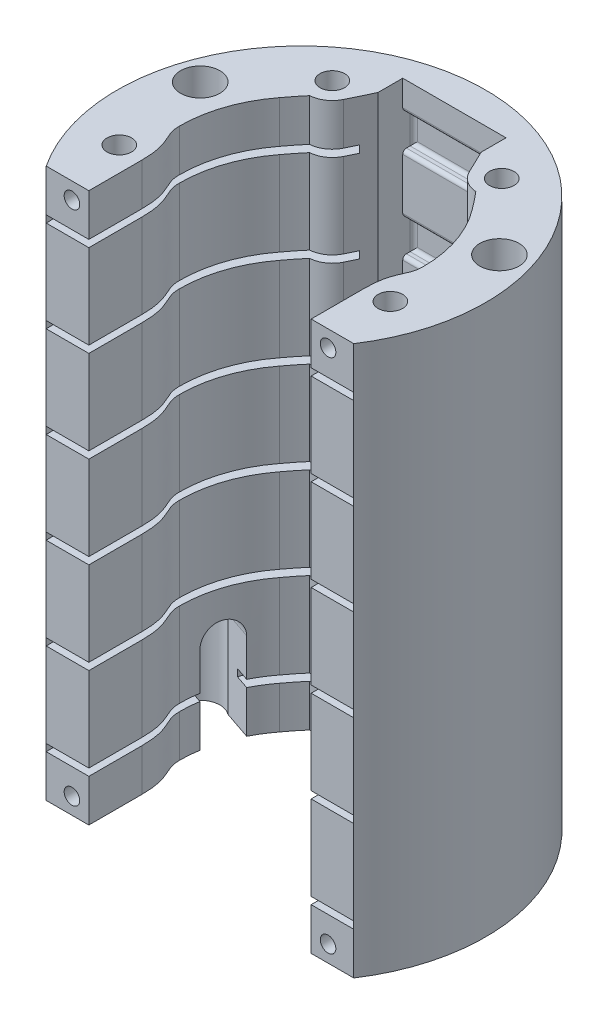
from build123d import *

# Parameters (mm, degrees)
SKETCH1_R               = 3.35
SKETCH1_R_2             = 5.3721
BOSS_EXTRUDE2_DEPTH     = 150
SLOT_DEPTH              = 0.975
SKETCH2_W               = 28.2
SKETCH2_H               = 9.048762348
CUT_EXTRUDE1_DEPTH      = 3
FILLET1_R               = 1
LPATTERN1_COUNT         = 6
LPATTERN1_PITCH         = 25
FILLET1_OF_LPATTERN1_R  = 1
SKETCH7_R               = 2.125
CUT_EXTRUDE2_DEPTH      = 8
CUT_EXTRUDE3_DEPTH      = 10
MIRROR2_COPY_1_SKETCH_R = 2.125
MIRROR2_COPY_1_DEPTH    = 8


with BuildPart() as part:
    # Sketch1 → Boss-Extrude2 (new body)
    with BuildSketch(Plane(origin=(0, 0, 0), x_dir=(1, 0, 0), z_dir=(0, 1, 0))):
        with BuildLine():
            Line((-41.978758021, -27.696013052), (-30.348758021, -27.696013052))
            Line((-30.348758021, -27.696013052), (-30.348758021, -13.232808954))
            add(Edge.make_bspline(
                [(-30.348758021, -13.232808954), (-30.348758021, -4.818714921), (-33.264468406, -4.744134389), (-33.264468406, 0)],
                knots=[0, 0, 0, 0, 1, 1, 1, 1], degree=3))
            ThreePointArc((-33.264468406, 0), (-31.488556898, 10.723602139), (-26.350445826, 20.302188629))
            add(Edge.make_bspline(
                [(-26.350445826, 20.302188629), (-24.374677003, 22.988127573), (-22.681011433, 24.921676571)],
                knots=[0, 0, 0, 1, 1, 1], degree=2))
            ThreePointArc((-22.681011433, 24.921676571), (-19.402847958, 26.048993856), (-17.137442499, 28.672948531))
            Line((-17.137442499, 28.672948531), (-14.1, 34.984991814))
            Line((-14.1, 34.984991814), (-14.1, 41.76))
            Line((-14.1, 41.76), (14.1, 41.76))
            Line((14.1, 41.76), (14.1, 34.984991814))
            Line((14.1, 34.984991814), (17.137442499, 28.672948531))
            ThreePointArc((17.137442499, 28.672948531), (19.402847958, 26.048993856), (22.681011433, 24.921676571))
            add(Edge.make_bspline(
                [(26.350445826, 20.302188629), (24.374677003, 22.988127573), (22.681011433, 24.921676571)],
                knots=[0, 0, 0, 1, 1, 1], degree=2))
            ThreePointArc((26.350445826, 20.302188629), (31.488556898, 10.723602139), (33.264468406, 0))
            add(Edge.make_bspline(
                [(30.348758021, -13.232808954), (30.348758021, -4.818714921), (33.264468406, -4.744134389), (33.264468406, 0)],
                knots=[0, 0, 0, 0, 1, 1, 1, 1], degree=3))
            Line((30.348758021, -13.232808954), (30.348758021, -27.696013052))
            Line((30.348758021, -27.696013052), (41.978758021, -27.696013052))
            ThreePointArc((41.978758021, -27.696013052), (0, 50.292), (-41.978758021, -27.696013052))
        make_face()
        with Locations((-37.000474826, -12.718618748)):
            Circle(SKETCH1_R, mode=Mode.SUBTRACT)
        with Locations((37.000474826, -12.718618748)):
            Circle(SKETCH1_R, mode=Mode.SUBTRACT)
        with Locations((-40.847062798, 13.209934169)):
            Circle(SKETCH1_R_2, mode=Mode.SUBTRACT)
        with Locations((-23.129730363, 31.556520301)):
            Circle(SKETCH1_R, mode=Mode.SUBTRACT)
        with Locations((40.847062798, 13.209934169)):
            Circle(SKETCH1_R_2, mode=Mode.SUBTRACT)
        with Locations((23.129730363, 31.556520301)):
            Circle(SKETCH1_R, mode=Mode.SUBTRACT)
    extrude(amount=BOSS_EXTRUDE2_DEPTH)

    # Sketch6 → slot (cut, symmetric)
    with BuildSketch(Plane(origin=(0, 12.5, 0), x_dir=(-1, 0, 0), z_dir=(0, -1, 0))):
        with BuildLine():
            Line((-41.978758021, -27.696013052), (41.978758021, -27.696013052))
            Line((41.978758021, -27.696013052), (42.348813141, -12.851950168))
            ThreePointArc((42.348813141, -12.851950168), (42.298623582, -11.975571138), (42.105800179, -11.119196027))
            Line((42.105800179, -11.119196027), (28.235055716, 33.155943022))
            ThreePointArc((28.235055716, 33.155943022), (24.341289072, 36.767530328), (19.253636812, 35.244120983))
            Line((19.253636812, 35.244120983), (13.047964359, 28.721243631))
            ThreePointArc((13.047964359, 28.721243631), (12.816725989, 28.560405037), (12.540811932, 28.50373344))
            Line((12.540811932, 28.50373344), (10.657647051, 28.50373344))
            ThreePointArc((10.657647051, 28.50373344), (10.516225695, 28.562312083), (10.457647051, 28.70373344))
            Line((10.457647051, 28.70373344), (10.457647051, 36.268969967))
            Line((10.457647051, 36.268969967), (9.766617018, 36.96))
            Line((9.766617018, 36.96), (-0.68191112, 36.96))
            Line((-0.68191112, 36.96), (-1.357647051, 36.284264069))
            Line((-1.357647051, 36.284264069), (-1.357647051, 29.218375638))
            ThreePointArc((-1.357647051, 29.218375638), (-2.007647051, 28.607259567), (-2.657647051, 29.218375638))
            Line((-2.657647051, 29.218375638), (-2.657647051, 36.284264069))
            Line((-2.657647051, 36.284264069), (-3.333382982, 36.96))
            Line((-3.333382982, 36.96), (-9.78191112, 36.96))
            Line((-9.78191112, 36.96), (-10.457647051, 36.284264069))
            Line((-10.457647051, 36.284264069), (-10.457647051, 28.70373344))
            ThreePointArc((-10.457647051, 28.70373344), (-10.516225695, 28.562312083), (-10.657647051, 28.50373344))
            Line((-10.657647051, 28.50373344), (-12.540811932, 28.50373344))
            ThreePointArc((-12.540811932, 28.50373344), (-12.816725989, 28.560405037), (-13.047964359, 28.721243631))
            Line((-13.047964359, 28.721243631), (-19.253636812, 35.244120983))
            ThreePointArc((-19.253636812, 35.244120983), (-24.341289072, 36.767530328), (-28.235055716, 33.155943022))
            Line((-28.235055716, 33.155943022), (-42.105800179, -11.119196027))
            ThreePointArc((-42.105800179, -11.119196027), (-42.298623582, -11.975571138), (-42.348813141, -12.851950168))
            Line((-42.348813141, -12.851950168), (-41.978758021, -27.696013052))
        make_face()
    slot = extrude(amount=SLOT_DEPTH, both=True, mode=Mode.SUBTRACT)

    # Sketch2 → Cut-Extrude1 (cut)
    with BuildSketch(Plane.XY.offset(-41.76)):
        with Locations((0, 12.5)):
            Rectangle(SKETCH2_W, SKETCH2_H)
    cut_extrude1 = extrude(amount=-CUT_EXTRUDE1_DEPTH, mode=Mode.SUBTRACT)

    # Fillet1
    fillet1_edges = [part.edges().sort_by_distance(p)[0] for p in [
        (0, 17.024381174, -44.76),
        (14.1, 12.5, -44.76),
        (0, 7.975618826, -44.76),
        (-14.1, 12.5, -44.76),
        (0, 7.975618826, -41.76),
        (0, 17.024381174, -41.76),
    ]]
    fillet(fillet1_edges, radius=FILLET1_R)

    # LPattern1: slot, Cut-Extrude1 ×6
    with Locations(*[(0, i * LPATTERN1_PITCH, 0) for i in range(1, LPATTERN1_COUNT)]):
        add(slot, mode=Mode.SUBTRACT)
        add(cut_extrude1, mode=Mode.SUBTRACT)

    # Fillet1 of LPattern1
    fillet1_of_lpattern1_edges = [part.edges().sort_by_distance(p)[0] for p in [
        (0, 42.024381174, -44.76),
        (14.1, 37.5, -44.76),
        (0, 32.975618826, -44.76),
        (-14.1, 37.5, -44.76),
        (0, 32.975618826, -41.76),
        (0, 42.024381174, -41.76),
        (0, 67.024381174, -44.76),
        (14.1, 62.5, -44.76),
        (0, 57.975618826, -44.76),
        (-14.1, 62.5, -44.76),
        (0, 57.975618826, -41.76),
        (0, 67.024381174, -41.76),
        (0, 92.024381174, -44.76),
        (14.1, 87.5, -44.76),
        (0, 82.975618826, -44.76),
        (-14.1, 87.5, -44.76),
        (0, 82.975618826, -41.76),
        (0, 92.024381174, -41.76),
        (0, 117.024381174, -44.76),
        (14.1, 112.5, -44.76),
        (0, 107.975618826, -44.76),
        (-14.1, 112.5, -44.76),
        (0, 107.975618826, -41.76),
        (0, 117.024381174, -41.76),
        (0, 142.024381174, -44.76),
        (14.1, 137.5, -44.76),
        (0, 132.975618826, -44.76),
        (-14.1, 137.5, -44.76),
        (0, 132.975618826, -41.76),
        (0, 142.024381174, -41.76),
    ]]
    fillet(fillet1_of_lpattern1_edges, radius=FILLET1_OF_LPATTERN1_R)

    # Sketch7 → Cut-Extrude2 (cut)
    with BuildSketch(Plane.XY.offset(27.696013052)):
        with Locations((34.962080117, 4.5125)):
            Circle(SKETCH7_R)
    cut_extrude2 = extrude(amount=-CUT_EXTRUDE2_DEPTH, mode=Mode.SUBTRACT)

    # Sketch9 → Cut-Extrude3 (cut)
    with BuildSketch(Plane(origin=(-29.807457116, 0, -10.151094314), x_dir=(0.32237407218801245, 0, -0.9466123586669034), z_dir=(0.9466123586669035, 0, 0.3223740721880125))):
        with BuildLine():
            Line((4.437094583, 0), (4.437094583, 23.781860263))
            ThreePointArc((4.437094583, 23.781860263), (-0.642905417, 28.861860263), (-5.722905417, 23.781860263))
            Line((-5.722905417, 23.781860263), (-5.722905417, 0))
            Line((-5.722905417, 0), (4.437094583, 0))
        make_face()
    cut_extrude3 = extrude(amount=-CUT_EXTRUDE3_DEPTH, mode=Mode.SUBTRACT)

    # Mirror1: Cut-Extrude2 across plane
    add(cut_extrude2.mirror(Plane(origin=(0, 0, 0), x_dir=(0, 0, 1), z_dir=(1, 0, 0))), mode=Mode.SUBTRACT)

    # Mirror2: Cut-Extrude2 across plane
    add(cut_extrude2.mirror(Plane(origin=(0, 75, 0), x_dir=(0, 0, 1), z_dir=(0, -1, 0))), mode=Mode.SUBTRACT)

    # Mirror2 copy 1 sketch → Mirror2 copy 1 (cut)
    with BuildSketch(Plane(origin=(0, 150, 27.696013052), x_dir=(-1, 0, 0), z_dir=(0, 0, 1))):
        with Locations((34.962080117, 4.5125)):
            Circle(MIRROR2_COPY_1_SKETCH_R)
    extrude(amount=-MIRROR2_COPY_1_DEPTH, mode=Mode.SUBTRACT)

    # Mirror3: Cut-Extrude3 across plane
    add(cut_extrude3.mirror(Plane(origin=(0, 0, 0), x_dir=(0, 0, 1), z_dir=(1, 0, 0))), mode=Mode.SUBTRACT)


solid = part.part
